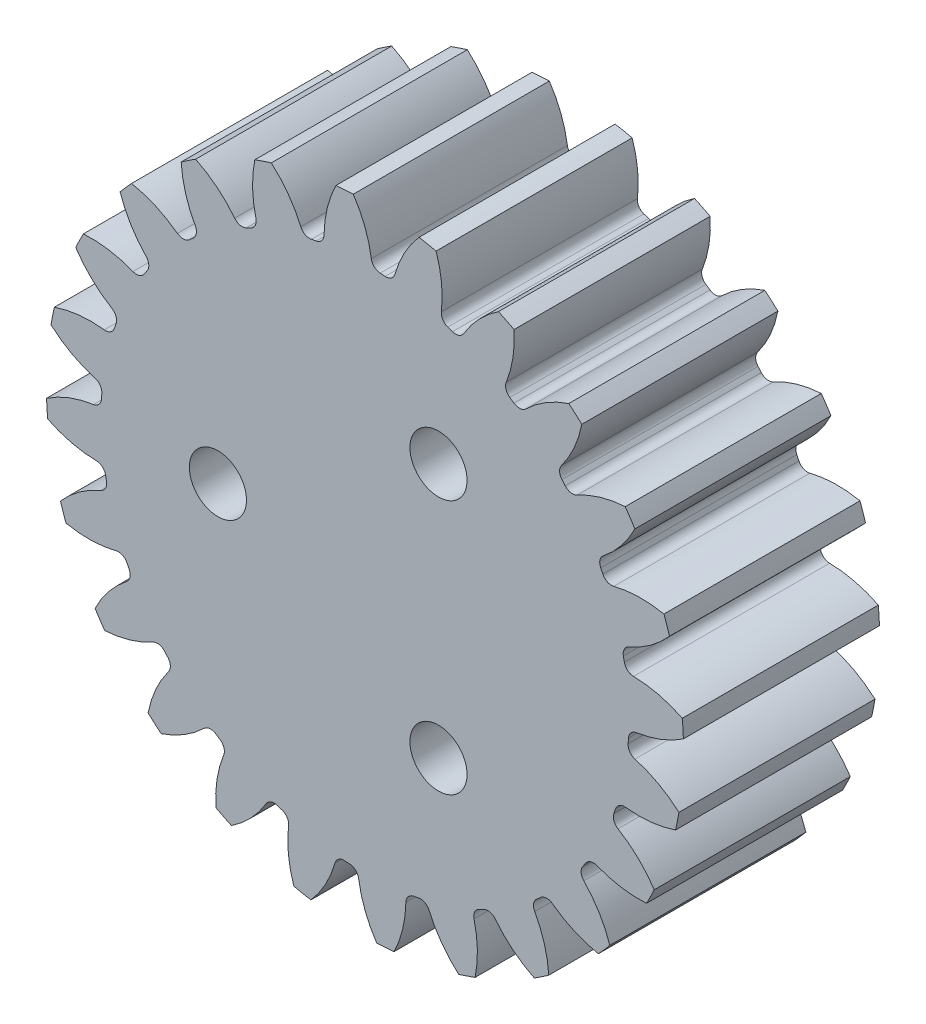
from build123d import *

# Parameters (mm, degrees)
SKETCH3_R          = 20.6375
GEARBODY_DEPTH     = 12.7
TOOTHCUT_DEPTH     = 32.829276029
CIRPATTERN1_COUNT  = 24
SKETCH4_R          = 1.849999983
CUT_EXTRUDE1_DEPTH = 32.811300403


with BuildPart() as part:
    # Sketch3 → gearBody (new body)
    with BuildSketch(Plane.XY):
        Circle(SKETCH3_R)
    extrude(amount=GEARBODY_DEPTH)

    # Sketch2 → toothCut (cut, through all)
    with BuildSketch(Plane.XY):
        with BuildLine():
            ThreePointArc((17.04439181, -1.303986765), (17.05590718, -1.14354882), (17.065912391, -0.983009622))
            ThreePointArc((17.065912391, -0.983009622), (17.226475942, -0.603092534), (17.591114308, -0.410332293))
            ThreePointArc((17.591114308, -0.410332293), (20.42378314, 0.626979823), (22.599606758, 2.716434472))
            ThreePointArc((22.599606758, 2.716434472), (22.711286815, -1.522725526), (22.034703624, -5.709034773))
            ThreePointArc((22.034703624, -5.709034773), (20.157284273, -3.347822008), (17.488443939, -1.941649751))
            ThreePointArc((17.488443939, -1.941649751), (17.152801577, -1.701937731), (17.04439181, -1.303986765))
        make_face()
    toothcut = extrude(amount=TOOTHCUT_DEPTH, mode=Mode.SUBTRACT)

    # CirPattern1: toothCut ×24 about axis
    cirpattern1_axis = Axis((0, 0, 12.7), (0, 0, -1))
    for i in range(1, CIRPATTERN1_COUNT):
        add(toothcut.rotate(cirpattern1_axis, i * 360 / CIRPATTERN1_COUNT), mode=Mode.SUBTRACT)

    # Sketch4 → Cut-Extrude1 (cut, through all)
    with BuildSketch(Plane(origin=(0, 0, 0), x_dir=(-1, 0, 0), z_dir=(0, 0, -1))):
        with Locations((9.525, 0)):
            Circle(SKETCH4_R)
        with Locations((-4.7625, -8.248891971)):
            Circle(SKETCH4_R)
        with Locations((-4.7625, 8.248891971)):
            Circle(SKETCH4_R)
    extrude(amount=-CUT_EXTRUDE1_DEPTH, mode=Mode.SUBTRACT)


solid = part.part
